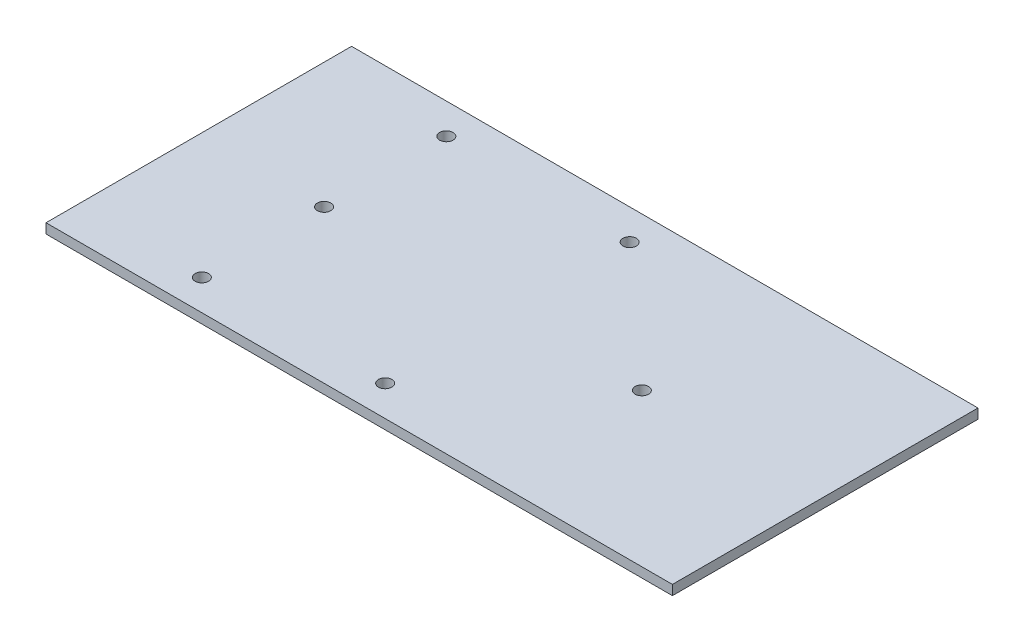
from build123d import *

# Parameters (mm, degrees)
SKETCH1_W           = 102.5
SKETCH1_H           = 50
BOSS_EXTRUDE1_DEPTH = 1.6
SKETCH2_R           = 1.1
CUT_EXTRUDE1_DEPTH  = 115.056170372


with BuildPart() as part:
    # Sketch1 → Boss-Extrude1 (new body)
    with BuildSketch(Plane(origin=(0, 0, 0), x_dir=(1, 0, 0), z_dir=(0, 1, 0))):
        with Locations((51.25, 25)):
            Rectangle(SKETCH1_W, SKETCH1_H)
    extrude(amount=BOSS_EXTRUDE1_DEPTH)

    # Sketch2 → Cut-Extrude1 (cut, through all)
    with BuildSketch(Plane(origin=(0, 1.6, 0), x_dir=(1, 0, 0), z_dir=(0, 1, 0))):
        with Locations((20.5, 5)):
            Circle(SKETCH2_R)
        with Locations((20.5, 25)):
            Circle(SKETCH2_R)
        with Locations((20.5, 45)):
            Circle(SKETCH2_R)
        with Locations((50.5, 45)):
            Circle(SKETCH2_R)
        with Locations((50.5, 5)):
            Circle(SKETCH2_R)
        with Locations((72.5, 25)):
            Circle(SKETCH2_R)
    extrude(amount=-CUT_EXTRUDE1_DEPTH, mode=Mode.SUBTRACT)


solid = part.part
